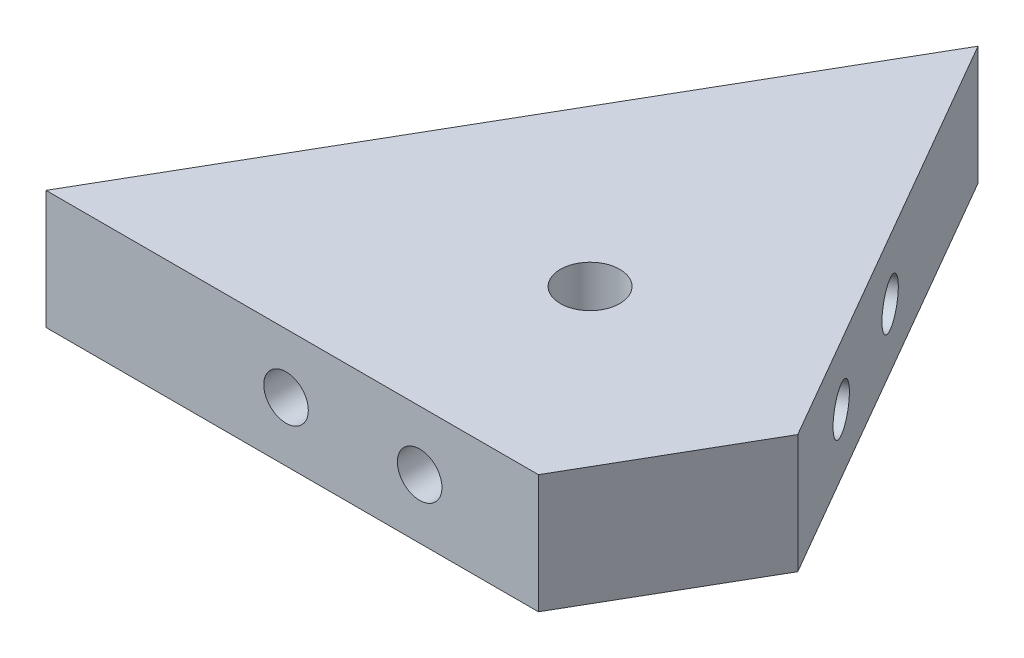
from build123d import *

# Parameters (mm, degrees)
BOSS_EXTRUDE1_DEPTH = 25.4
SKETCH2_R           = 4.7625
CUT_EXTRUDE1_DEPTH  = 12.7
SKETCH3_R           = 3.96875
CUT_EXTRUDE2_DEPTH  = 12.7
SKETCH4_R           = 3.96875
CUT_EXTRUDE3_DEPTH  = 12.7
SKETCH5_R           = 6.35
CUT_EXTRUDE4_DEPTH  = 280.690442894


with BuildPart() as part:
    # Sketch1 → Boss-Extrude1 (new body)
    with BuildSketch(Plane(origin=(0, 0, 0), x_dir=(1, 0, 0), z_dir=(0, 1, 0))):
        Polygon((119.068292428, -241.162389864), (129.21607637, -223.585912492), (50.239997171, -177.989051908), (13.766853497, -241.162389864), align=None)
    boss_extrude1 = extrude(amount=BOSS_EXTRUDE1_DEPTH)

    # Sketch2 → Cut-Extrude1 (cut)
    with BuildSketch(Plane.XY.offset(241.162389864)):
        with Locations((65.093292428, 12.7)):
            Circle(SKETCH2_R)
        with Locations((93.668292428, 12.7)):
            Circle(SKETCH2_R)
    cut_extrude1 = extrude(amount=-CUT_EXTRUDE1_DEPTH, mode=Mode.SUBTRACT)

    # Sketch3 → Cut-Extrude2 (cut)
    with BuildSketch(Plane.XY.offset(228.462389864)):
        with Locations((65.093292428, 12.7)):
            Circle(SKETCH3_R)
    cut_extrude2 = extrude(amount=-CUT_EXTRUDE2_DEPTH, mode=Mode.SUBTRACT)

    # Sketch4 → Cut-Extrude3 (cut)
    with BuildSketch(Plane.XY.offset(228.462389864)):
        with Locations((93.668292428, 12.7)):
            Circle(SKETCH4_R)
    cut_extrude3 = extrude(amount=-CUT_EXTRUDE3_DEPTH, mode=Mode.SUBTRACT)

    # Mirror1: Boss-Extrude1, Cut-Extrude1, Cut-Extrude2, Cut-Extrude3 across plane
    add(boss_extrude1.mirror(Plane(origin=(50.239997171, 25.4, 177.989051908), x_dir=(0.8660254037844389, 0, 0.4999999999999996), z_dir=(-0.49999999999999983, 0, 0.8660254037844388))))
    add(cut_extrude1.mirror(Plane(origin=(50.239997171, 25.4, 177.989051908), x_dir=(0.8660254037844389, 0, 0.4999999999999996), z_dir=(-0.49999999999999983, 0, 0.8660254037844388))), mode=Mode.SUBTRACT)
    add(cut_extrude2.mirror(Plane(origin=(50.239997171, 25.4, 177.989051908), x_dir=(0.8660254037844389, 0, 0.4999999999999996), z_dir=(-0.49999999999999983, 0, 0.8660254037844388))), mode=Mode.SUBTRACT)
    add(cut_extrude3.mirror(Plane(origin=(50.239997171, 25.4, 177.989051908), x_dir=(0.8660254037844389, 0, 0.4999999999999996), z_dir=(-0.49999999999999983, 0, 0.8660254037844388))), mode=Mode.SUBTRACT)

    # Sketch5 → Cut-Extrude4 (cut, through all)
    with BuildSketch(Plane(origin=(0, 25.4, 0), x_dir=(1, 0, 0), z_dir=(0, 1, 0))):
        with Locations((89.728036771, -200.7874822)):
            Circle(SKETCH5_R)
    extrude(amount=-CUT_EXTRUDE4_DEPTH, mode=Mode.SUBTRACT)


solid = part.part
